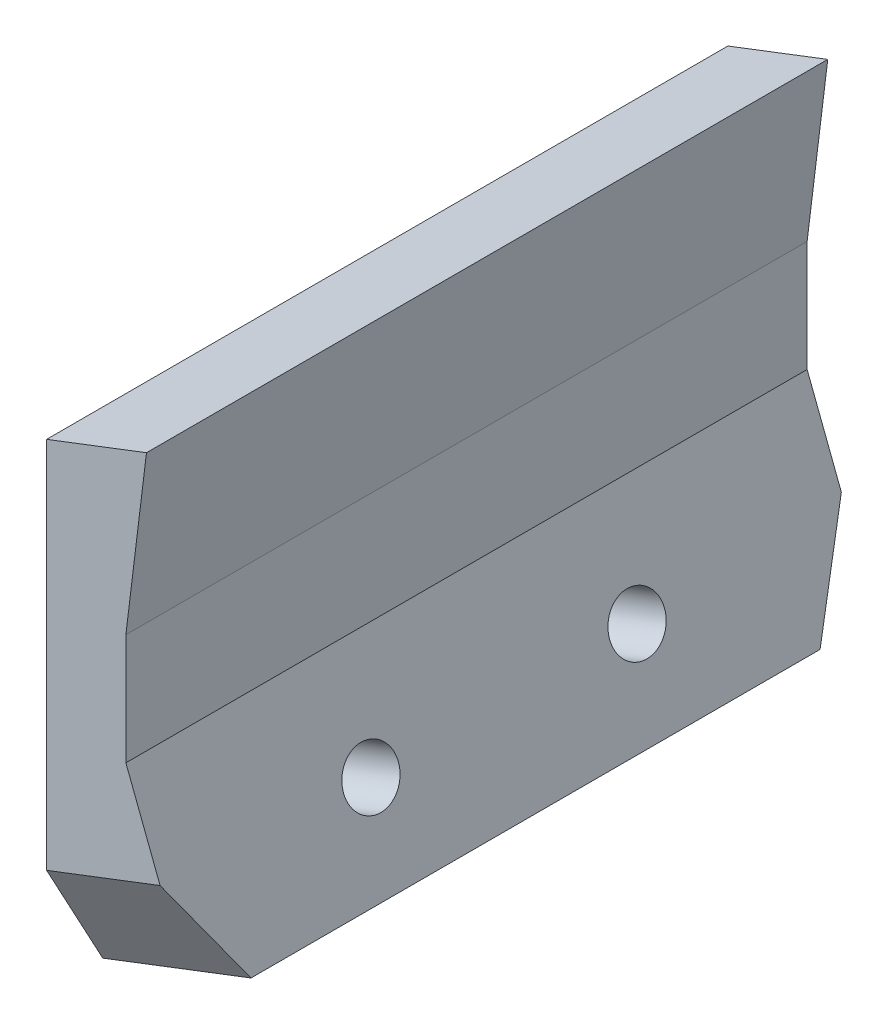
from build123d import *

# Parameters (mm, degrees)
EXTRUDE_1020_DEPTH     = 40.639999
CUT_EXTRUDE_START      = -9.474731536
CUT_EXTRUDE_1457_DEPTH = 9.474731536
SKETCH_5_6_R           = 1.631950308
EXTRUDE_1503_DEPTH     = 8.257914
CUT_EXTRUDE_2395_REACH = 52.464
SKETCH_11_R            = 2.75
CUT_EXTRUDE_2_REACH    = 52.464
SKETCH_18_R            = 2.75


# Read off the part's stored shape, not the designer's step: 切割边缘
with BuildPart() as part:
    # Sketch 255 → Extrude 1020 (new body)
    with BuildSketch(Plane.XY):
        Polygon((4.726521015, 20.743641369), (4.726521015, 19.19011116), (4.726521015, 14.125546455), (8.845423698, 3.395440102), (0, -5.59e-07), (0, 28.474460602), (5.956491721, 30.760943971), (5.827697754, 29.712001801), (4.915848732, 22.285591125), align=None)
    extrude(amount=EXTRUDE_1020_DEPTH)

    # Cut-Extrude 1457 outline → Cut-Extrude 1457 (cut)
    with BuildSketch(Plane(origin=(8.845423511, 3.395440589, 0), x_dir=(0, 0, -1), z_dir=(0.9335804043176853, 0.35836800732491086, 0)).offset(CUT_EXTRUDE_START)):
        Polygon((-37.293439923, -5.22e-07), (-40.63999939, 5.796406388), (-40.63999939, -5.22e-07), align=None)
    cut_extrude_1457 = extrude(amount=CUT_EXTRUDE_1457_DEPTH, mode=Mode.SUBTRACT)

    # 草图5<6> → Extrude 1503 (add)
    with BuildSketch(Plane(origin=(8.845423511, 3.395440589, 0), x_dir=(0, 0, -1), z_dir=(0.9335804043176853, 0.35836800732491086, 0))):
        with Locations(Location((-28.25750129, 5.25344969, 0), (0, 0, 90))):
            Circle(SKETCH_5_6_R)
    extrude_1503 = extrude(amount=-EXTRUDE_1503_DEPTH)

    # 镜向6: Cut-Extrude 1457, Extrude 1503 across plane
    add(cut_extrude_1457.mirror(Plane.XY.offset(20.319999695)), mode=Mode.SUBTRACT)
    add(extrude_1503.mirror(Plane.XY.offset(20.319999695)))

    # 草图10 → M2.5 凹头盖螺钉的柱形沉头孔2 (revolve, cut)
    with BuildSketch(Plane(origin=(-0.746671694, 5.340586006, 28.25750129), x_dir=(0.3583680073249109, -0.9335804043176852, 0), z_dir=(0, 0, 1))):
        Polygon((0, 0), (0, 18.064835324), (1.635, 18.064835324), (1.635, 2.5), (2.75, 2.5), (2.75, 0.025), (2.775, 0), align=None)
    revolve(axis=Axis((-6.674907261, 3.06494916, 28.25750129), (0.9335804043176852, 0.358368007324911, 0)), mode=Mode.SUBTRACT)

    # 草图11 → Cut-Extrude 2395 (cut, up to next)
    with BuildSketch(Plane(origin=(3.469947614, 1.331988339, 0), x_dir=(0, 0, 1), z_dir=(-0.9335804043176853, -0.3583680073249109, 0)), mode=Mode.PRIVATE) as cut_extrude_2395_sk1:
        with Locations(Location((28.25750129, 5.25344969, 0), (0, 0, 270))):
            Circle(SKETCH_11_R)
    cut_extrude_2395_tool1 = extrude(cut_extrude_2395_sk1.sketch, amount=CUT_EXTRUDE_2395_REACH, mode=Mode.PRIVATE) & part.part
    add(cut_extrude_2395_tool1.solids().sort_by_distance((1.587279, 6.236506, 28.257501))[0], mode=Mode.SUBTRACT)

    # 草图17 → M2.5 凹头盖螺钉的柱形沉头孔5 (revolve, cut)
    with BuildSketch(Plane(origin=(-0.746671694, 5.340586006, 12.3824981), x_dir=(0.3583680073249109, -0.9335804043176852, 0), z_dir=(0, 0, 1))):
        Polygon((0, 0), (0, 18.064835324), (1.635, 18.064835324), (1.635, 2.5), (2.75, 2.5), (2.75, 0.025), (2.775, 0), align=None)
    revolve(axis=Axis((-6.674907261, 3.06494916, 12.3824981), (0.9335804043176852, 0.358368007324911, 0)), mode=Mode.SUBTRACT)

    # 草图18 → 修整螺丝2 (cut, up to next)
    with BuildSketch(Plane(origin=(3.469947614, 1.331988339, 0), x_dir=(0, 0, 1), z_dir=(-0.9335804043176853, -0.3583680073249109, 0)), mode=Mode.PRIVATE) as cut_extrude_2_sk1:
        with Locations(Location((12.3824981, 5.25344969, 0), (0, 0, 270))):
            Circle(SKETCH_18_R)
    cut_extrude_2_tool1 = extrude(cut_extrude_2_sk1.sketch, amount=CUT_EXTRUDE_2_REACH, mode=Mode.PRIVATE) & part.part
    add(cut_extrude_2_tool1.solids().sort_by_distance((1.587279, 6.236506, 12.382498))[0], mode=Mode.SUBTRACT)


solid = part.part
